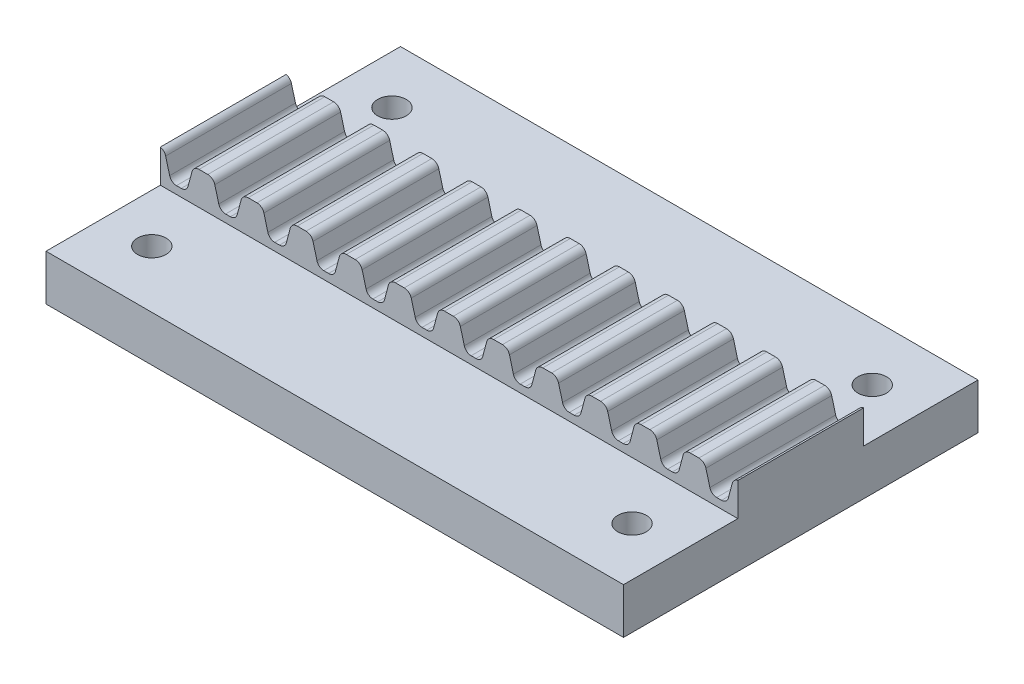
from build123d import *

# Parameters (mm, degrees)
SKETCH3_W           = 22
SKETCH3_H           = 5.7785
BOSS_EXTRUDE2_DEPTH = 101
CUT_EXTRUDE1_DEPTH  = 104.529662717
FILLET1_R           = 1.2637
SKETCH10_W          = 101
SKETCH10_H          = 62
BOSS_EXTRUDE6_DEPTH = 8
SKETCH11_R          = 2.5
CUT_EXTRUDE2_DEPTH  = 110.676797911
SKETCH12_R          = 2.5
CUT_EXTRUDE3_DEPTH  = 110.676797911


with BuildPart() as part:
    # Sketch3 → Boss-Extrude2 (new body)
    with BuildSketch(Plane(origin=(0, 0, 0), x_dir=(0, 0, -1), z_dir=(1, 0, 0))):
        with Locations((11, 2.88925)):
            Rectangle(SKETCH3_W, SKETCH3_H)
    extrude(amount=-BOSS_EXTRUDE2_DEPTH)

    # Sketch5 → Cut-Extrude1 (cut, through all)
    with BuildSketch(Plane(origin=(0, 0, 0), x_dir=(-1, 0, 0), z_dir=(0, 0, -1))):
        with BuildLine():
            Line((1.674138493, 2.258445519), (0.421264214, 6.934235985))
            Line((0.421264214, 6.934235985), (6.147128546, 6.934235985))
            Line((6.147128546, 6.934235985), (4.894261507, 2.258445519))
            ThreePointArc((4.894261507, 2.258445519), (4.454663567, 1.600540709), (3.7054, 1.3462))
            Line((3.7054, 1.3462), (2.863, 1.3462))
            ThreePointArc((2.863, 1.3462), (2.113736433, 1.600540709), (1.674138493, 2.258445519))
        make_face()
        with BuildLine():
            Line((10.263138493, 2.258445519), (9.010264214, 6.934235985))
            Line((9.010264214, 6.934235985), (14.736128546, 6.934235985))
            Line((14.736128546, 6.934235985), (13.483261507, 2.258445519))
            ThreePointArc((13.483261507, 2.258445519), (13.043663567, 1.600540709), (12.2944, 1.3462))
            Line((12.2944, 1.3462), (11.452, 1.3462))
            ThreePointArc((11.452, 1.3462), (10.702736433, 1.600540709), (10.263138493, 2.258445519))
        make_face()
        with BuildLine():
            Line((18.852138493, 2.258445519), (17.599264214, 6.934235985))
            Line((17.599264214, 6.934235985), (23.325128546, 6.934235985))
            Line((23.325128546, 6.934235985), (22.072261507, 2.258445519))
            ThreePointArc((22.072261507, 2.258445519), (21.632663567, 1.600540709), (20.8834, 1.3462))
            Line((20.8834, 1.3462), (20.041, 1.3462))
            ThreePointArc((20.041, 1.3462), (19.291736433, 1.600540709), (18.852138493, 2.258445519))
        make_face()
        with BuildLine():
            Line((27.441138493, 2.258445519), (26.188264214, 6.934235985))
            Line((26.188264214, 6.934235985), (31.914128546, 6.934235985))
            Line((31.914128546, 6.934235985), (30.661261507, 2.258445519))
            ThreePointArc((30.661261507, 2.258445519), (30.221663567, 1.600540709), (29.4724, 1.3462))
            Line((29.4724, 1.3462), (28.63, 1.3462))
            ThreePointArc((28.63, 1.3462), (27.880736433, 1.600540709), (27.441138493, 2.258445519))
        make_face()
        with BuildLine():
            Line((36.030138493, 2.258445519), (34.777264214, 6.934235985))
            Line((34.777264214, 6.934235985), (40.503128546, 6.934235985))
            Line((40.503128546, 6.934235985), (39.250261507, 2.258445519))
            ThreePointArc((39.250261507, 2.258445519), (38.810663567, 1.600540709), (38.0614, 1.3462))
            Line((38.0614, 1.3462), (37.219, 1.3462))
            ThreePointArc((37.219, 1.3462), (36.469736433, 1.600540709), (36.030138493, 2.258445519))
        make_face()
        with BuildLine():
            Line((44.619138493, 2.258445519), (43.366264214, 6.934235985))
            Line((43.366264214, 6.934235985), (49.092128546, 6.934235985))
            Line((49.092128546, 6.934235985), (47.839261507, 2.258445519))
            ThreePointArc((47.839261507, 2.258445519), (47.399663567, 1.600540709), (46.6504, 1.3462))
            Line((46.6504, 1.3462), (45.808, 1.3462))
            ThreePointArc((45.808, 1.3462), (45.058736433, 1.600540709), (44.619138493, 2.258445519))
        make_face()
        with BuildLine():
            Line((53.208138493, 2.258445519), (51.955264214, 6.934235985))
            Line((51.955264214, 6.934235985), (57.681128546, 6.934235985))
            Line((57.681128546, 6.934235985), (56.428261507, 2.258445519))
            ThreePointArc((56.428261507, 2.258445519), (55.988663567, 1.600540709), (55.2394, 1.3462))
            Line((55.2394, 1.3462), (54.397, 1.3462))
            ThreePointArc((54.397, 1.3462), (53.647736433, 1.600540709), (53.208138493, 2.258445519))
        make_face()
        with BuildLine():
            Line((61.797138493, 2.258445519), (60.544264214, 6.934235985))
            Line((60.544264214, 6.934235985), (66.270128546, 6.934235985))
            Line((66.270128546, 6.934235985), (65.017261507, 2.258445519))
            ThreePointArc((65.017261507, 2.258445519), (64.577663567, 1.600540709), (63.8284, 1.3462))
            Line((63.8284, 1.3462), (62.986, 1.3462))
            ThreePointArc((62.986, 1.3462), (62.236736433, 1.600540709), (61.797138493, 2.258445519))
        make_face()
        with BuildLine():
            Line((70.386138493, 2.258445519), (69.133264214, 6.934235985))
            Line((69.133264214, 6.934235985), (74.859128546, 6.934235985))
            Line((74.859128546, 6.934235985), (73.606261507, 2.258445519))
            ThreePointArc((73.606261507, 2.258445519), (73.166663567, 1.600540709), (72.4174, 1.3462))
            Line((72.4174, 1.3462), (71.575, 1.3462))
            ThreePointArc((71.575, 1.3462), (70.825736433, 1.600540709), (70.386138493, 2.258445519))
        make_face()
        with BuildLine():
            Line((78.975138493, 2.258445519), (77.722264214, 6.934235985))
            Line((77.722264214, 6.934235985), (83.448128546, 6.934235985))
            Line((83.448128546, 6.934235985), (82.195261507, 2.258445519))
            ThreePointArc((82.195261507, 2.258445519), (81.755663567, 1.600540709), (81.0064, 1.3462))
            Line((81.0064, 1.3462), (80.164, 1.3462))
            ThreePointArc((80.164, 1.3462), (79.414736433, 1.600540709), (78.975138493, 2.258445519))
        make_face()
        with BuildLine():
            Line((87.564138493, 2.258445519), (86.311264214, 6.934235985))
            Line((86.311264214, 6.934235985), (92.037128546, 6.934235985))
            Line((92.037128546, 6.934235985), (90.784261507, 2.258445519))
            ThreePointArc((90.784261507, 2.258445519), (90.344663567, 1.600540709), (89.5954, 1.3462))
            Line((89.5954, 1.3462), (88.753, 1.3462))
            ThreePointArc((88.753, 1.3462), (88.003736433, 1.600540709), (87.564138493, 2.258445519))
        make_face()
        with BuildLine():
            Line((96.153138493, 2.258445519), (94.900264214, 6.934235985))
            Line((94.900264214, 6.934235985), (100.626128546, 6.934235985))
            Line((100.626128546, 6.934235985), (99.373261507, 2.258445519))
            ThreePointArc((99.373261507, 2.258445519), (98.933663567, 1.600540709), (98.1844, 1.3462))
            Line((98.1844, 1.3462), (97.342, 1.3462))
            ThreePointArc((97.342, 1.3462), (96.592736433, 1.600540709), (96.153138493, 2.258445519))
        make_face()
    extrude(amount=CUT_EXTRUDE1_DEPTH, mode=Mode.SUBTRACT)

    # Fillet1
    # the kernel refuses this fillet: 1.2637 mm, written as the material it takes off along each edge
    with BuildSketch(Plane(origin=(-14.426451812, 5.7785, -24.424181413), x_dir=(-1, 0, 0), z_dir=(0, 0, 1)), Plane(origin=(-23.015451812, 5.7785, -24.424181413), x_dir=(-1, 0, 0), z_dir=(0, 0, 1)), Plane(origin=(-31.604451812, 5.7785, -24.424181413), x_dir=(-1, 0, 0), z_dir=(0, 0, 1)), Plane(origin=(-40.193451812, 5.7785, -24.424181413), x_dir=(-1, 0, 0), z_dir=(0, 0, 1)), Plane(origin=(-48.782451812, 5.7785, -24.424181413), x_dir=(-1, 0, 0), z_dir=(0, 0, 1)), Plane(origin=(-57.371451812, 5.7785, -24.424181413), x_dir=(-1, 0, 0), z_dir=(0, 0, 1)), Plane(origin=(-65.960451812, 5.7785, -24.424181413), x_dir=(-1, 0, 0), z_dir=(0, 0, 1)), Plane(origin=(-74.549451812, 5.7785, -24.424181413), x_dir=(-1, 0, 0), z_dir=(0, 0, 1)), Plane(origin=(-83.138451812, 5.7785, -24.424181413), x_dir=(-1, 0, 0), z_dir=(0, 0, 1)), Plane(origin=(-91.727451812, 5.7785, -24.424181413), x_dir=(-1, 0, 0), z_dir=(0, 0, 1)), Plane(origin=(-5.837451812, 5.7785, -24.424181413), x_dir=(-1, 0, 0), z_dir=(0, 0, 1))) as fillet1_piece_1:
        with BuildLine():
            CenterArc((FILLET1_R * 0.767328135667, FILLET1_R), FILLET1_R, 194.999917223, 75.000082777)
            Line((-FILLET1_R * 0.198598064545, FILLET1_R * 0.7411823504), (-FILLET1_R * 0.217916588549, FILLET1_R * 0.736005997408))
            Line((-FILLET1_R * 0.217916588549, FILLET1_R * 0.736005997408), (-FILLET1_R * 0.0153465627133, -FILLET1_R * 0.02))
            Line((-FILLET1_R * 0.0153465627133, -FILLET1_R * 0.02), (FILLET1_R * 0.767328135667, -FILLET1_R * 0.02))
            Line((FILLET1_R * 0.767328135667, -FILLET1_R * 0.02), (FILLET1_R * 0.767328135667, 0))
        make_face()
    extrude(amount=26.848362825, mode=Mode.SUBTRACT)
    with BuildSketch(Plane(origin=(-9.319942738, 5.7785, 2.424177787), x_dir=(-0.25881904510252474, -0.9659258262890672, 0), z_dir=(0, 0, -1)), Plane(origin=(-17.908942738, 5.7785, 2.424177787), x_dir=(-0.25881904510252474, -0.9659258262890672, 0), z_dir=(0, 0, -1)), Plane(origin=(-26.497942738, 5.7785, 2.424177787), x_dir=(-0.25881904510252496, -0.9659258262890672, 0), z_dir=(0, 0, -1)), Plane(origin=(-35.086942738, 5.7785, 2.424177787), x_dir=(-0.2588190451025256, -0.965925826289067, 0), z_dir=(0, 0, -1)), Plane(origin=(-43.675942738, 5.7785, 2.424177787), x_dir=(-0.2588190451025256, -0.965925826289067, 0), z_dir=(0, 0, -1)), Plane(origin=(-52.264942738, 5.7785, 2.424177787), x_dir=(-0.25881904510252424, -0.9659258262890673, 0), z_dir=(0, 0, -1)), Plane(origin=(-60.853942738, 5.7785, 2.424177787), x_dir=(-0.25881904510252424, -0.9659258262890673, 0), z_dir=(0, 0, -1)), Plane(origin=(-69.442942738, 5.7785, 2.424177787), x_dir=(-0.25881904510252607, -0.9659258262890669, 0), z_dir=(0, 0, -1)), Plane(origin=(-78.031942738, 5.7785, 2.424177787), x_dir=(-0.25881904510252607, -0.9659258262890669, 0), z_dir=(0, 0, -1)), Plane(origin=(-86.620942738, 5.7785, 2.424177787), x_dir=(-0.2588190451025252, -0.9659258262890671, 0), z_dir=(0, 0, -1)), Plane(origin=(-95.209942738, 5.7785, 2.424177787), x_dir=(-0.2588190451025268, -0.9659258262890666, 0), z_dir=(0, 0, -1))) as fillet1_piece_2:
        with BuildLine():
            CenterArc((FILLET1_R * 0.767326987979, -FILLET1_R), FILLET1_R, 90, 75)
            Line((-FILLET1_R * 0.19859883831, -FILLET1_R * 0.741180954897), (-FILLET1_R * 0.217917354836, -FILLET1_R * 0.736004573995))
            Line((-FILLET1_R * 0.217917354836, -FILLET1_R * 0.736004573995), (-FILLET1_R * 0.0153465397596, FILLET1_R * 0.02))
            Line((-FILLET1_R * 0.0153465397596, FILLET1_R * 0.02), (FILLET1_R * 0.767326987979, FILLET1_R * 0.02))
            Line((FILLET1_R * 0.767326987979, FILLET1_R * 0.02), (FILLET1_R * 0.767326987979, 0))
        make_face()
    extrude(amount=26.848355574, mode=Mode.SUBTRACT)
    with BuildSketch(Plane(origin=(-100.316451812, 5.7785, -24.33349599), x_dir=(-1, 0, 0), z_dir=(0, 0, 1))) as fillet1_piece_3:
        with BuildLine():
            CenterArc((0.97906096, 1.22866183), FILLET1_R, 194.999917223, 61.476400821)
            Line((-0.241579979, 0.901593966), (-0.265992798, 0.895052609))
            Line((-0.265992798, 0.895052609), (-0.024412819, -0.006541357))
            Line((-0.024412819, -0.006541357), (0, -0.025274))
            ThreePointArc((0, -0.025274), (0.341774094, -0.025274), (0.677637933, -0.024573237))
            Line((0.677637933, -0.024573237), (0.683548188, 0))
        make_face()
    extrude(amount=26.666991979, mode=Mode.SUBTRACT)
    with BuildSketch(Plane(origin=(-0.730942738, 5.7785, 2.362037613), x_dir=(-0.2588190451025249, -0.9659258262890672, 0), z_dir=(0, 0, -1))) as fillet1_piece_4:
        with BuildLine():
            CenterArc((0.944815045, -1.2637), FILLET1_R, 90, 63.813512011)
            Line((-0.189181901, -0.706036468), (-0.21186184, -0.694883197))
            ThreePointArc((-0.21186184, -0.694883197), (-0.11900376, -0.346476841), (-0.024412809, 0.006541393))
            Line((-0.024412809, 0.006541393), (0, 0.025274))
            Line((0, 0.025274), (0.944815045, 0.025274))
            Line((0.944815045, 0.025274), (0.944815045, 0))
        make_face()
    extrude(amount=26.724075226, mode=Mode.SUBTRACT)

    # Sketch10 → Boss-Extrude6 (add)
    with BuildSketch(Plane(origin=(0, 0, 0), x_dir=(1, 0, 0), z_dir=(0, 1, 0))):
        with Locations((-50.5, 11)):
            Rectangle(SKETCH10_W, SKETCH10_H)
    extrude(amount=-BOSS_EXTRUDE6_DEPTH)

    # Sketch11 → Cut-Extrude2 (cut, through all)
    with BuildSketch(Plane(origin=(0, 0, 0), x_dir=(1, 0, 0), z_dir=(0, 1, 0))):
        with Locations(Location((-8.5, -10, 0), (0, 0, 270))):
            Circle(SKETCH11_R)
        with Locations(Location((-92.5, -10, 0), (0, 0, 270))):
            Circle(SKETCH11_R)
    extrude(amount=-CUT_EXTRUDE2_DEPTH, mode=Mode.SUBTRACT)

    # Sketch12 → Cut-Extrude3 (cut, through all)
    with BuildSketch(Plane(origin=(0, 0, 0), x_dir=(1, 0, 0), z_dir=(0, 1, 0))):
        with Locations(Location((-8.5, 32, 0), (0, 0, 270))):
            Circle(SKETCH12_R)
        with Locations(Location((-92.5, 32, 0), (0, 0, 270))):
            Circle(SKETCH12_R)
    extrude(amount=-CUT_EXTRUDE3_DEPTH, mode=Mode.SUBTRACT)


solid = part.part
